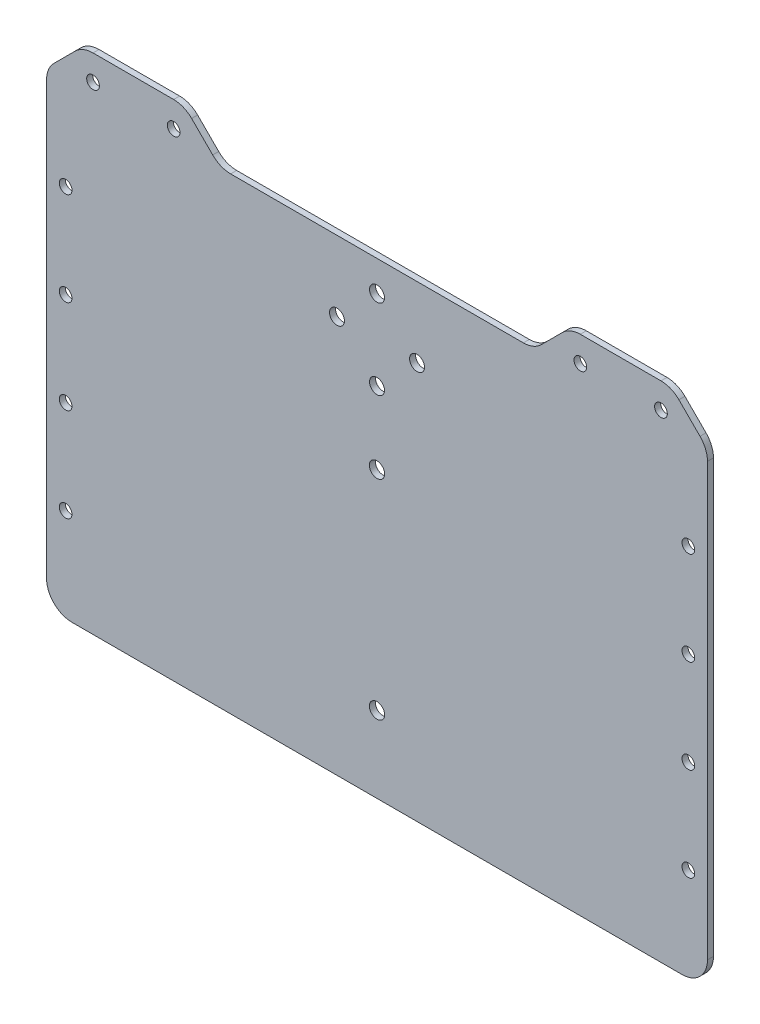
from build123d import *

# Parameters (mm, degrees)
SKETCH1_R           = 1.5875
BOSS_EXTRUDE1_DEPTH = 1.5
SKETCH2_R           = 1.906243542
CUT_EXTRUDE1_DEPTH  = 107.581175754
SKETCH3_R           = 1.8669
CUT_EXTRUDE2_DEPTH  = 107.581175754


with BuildPart() as part:
    # Sketch1 → Boss-Extrude1 (new body)
    with BuildSketch(Plane.XY):
        with BuildLine():
            Line((-82.55, 55.789743879), (-82.55, -52.07))
            ThreePointArc((-82.55, -52.07), (-80.690128061, -56.560128061), (-76.2, -58.42))
            Line((-76.2, -58.42), (76.2, -58.42))
            ThreePointArc((76.2, -58.42), (80.690128061, -56.560128061), (82.55, -52.07))
            Line((82.55, -52.07), (82.55, 55.789743879))
            ThreePointArc((82.55, 55.789743879), (82.066635031, 58.219783674), (80.690128061, 60.279871939))
            Line((80.690128061, 60.279871939), (75.429615818, 65.540384182))
            ThreePointArc((75.429615818, 65.540384182), (73.369527553, 66.916891153), (70.939487758, 67.400256121))
            Line((70.939487758, 67.400256121), (50.8, 67.400256121))
            ThreePointArc((50.8, 67.400256121), (48.369960204, 66.916891153), (46.309871939, 65.540384182))
            Line((46.309871939, 65.540384182), (41.049359697, 60.279871939))
            ThreePointArc((41.049359697, 60.279871939), (38.989271432, 58.903364969), (36.559231637, 58.42))
            Line((36.559231637, 58.42), (0, 58.42))
            Line((0, 58.42), (-36.559231637, 58.42))
            ThreePointArc((-36.559231637, 58.42), (-38.989271432, 58.903364969), (-41.049359697, 60.279871939))
            Line((-41.049359697, 60.279871939), (-46.309871939, 65.540384182))
            ThreePointArc((-46.309871939, 65.540384182), (-48.369960204, 66.916891153), (-50.8, 67.400256121))
            Line((-50.8, 67.400256121), (-70.939487758, 67.400256121))
            ThreePointArc((-70.939487758, 67.400256121), (-73.369527553, 66.916891153), (-75.429615818, 65.540384182))
            Line((-75.429615818, 65.540384182), (-80.690128061, 60.279871939))
            ThreePointArc((-80.690128061, 60.279871939), (-82.066635031, 58.219783674), (-82.55, 55.789743879))
        make_face()
        with Locations((-77.7875, -35.052)):
            Circle(SKETCH1_R, mode=Mode.SUBTRACT)
        with Locations((-77.7875, -11.684)):
            Circle(SKETCH1_R, mode=Mode.SUBTRACT)
        with Locations((-77.7875, 11.684)):
            Circle(SKETCH1_R, mode=Mode.SUBTRACT)
        with Locations((-77.7875, 35.052)):
            Circle(SKETCH1_R, mode=Mode.SUBTRACT)
        with Locations((77.7875, 35.052)):
            Circle(SKETCH1_R, mode=Mode.SUBTRACT)
        with Locations((77.7875, 11.684)):
            Circle(SKETCH1_R, mode=Mode.SUBTRACT)
        with Locations((77.7875, -11.684)):
            Circle(SKETCH1_R, mode=Mode.SUBTRACT)
        with Locations((77.7875, -35.052)):
            Circle(SKETCH1_R, mode=Mode.SUBTRACT)
        with Locations((-70.939487758, 61.050256121)):
            Circle(SKETCH1_R, mode=Mode.SUBTRACT)
        with Locations((-50.8, 61.050256121)):
            Circle(SKETCH1_R, mode=Mode.SUBTRACT)
        with Locations((50.8, 61.050256121)):
            Circle(SKETCH1_R, mode=Mode.SUBTRACT)
        with Locations((70.939487758, 61.050256121)):
            Circle(SKETCH1_R, mode=Mode.SUBTRACT)
    extrude(amount=BOSS_EXTRUDE1_DEPTH)

    # Sketch2 → Cut-Extrude1 (cut, through all)
    with BuildSketch(Plane.XY.offset(1.5)):
        with Locations((0, -39.37)):
            Circle(SKETCH2_R)
        with Locations((0, 12.713414375)):
            Circle(SKETCH2_R)
    extrude(amount=-CUT_EXTRUDE1_DEPTH, mode=Mode.SUBTRACT)

    # Sketch3 → Cut-Extrude2 (cut, through all)
    with BuildSketch(Plane.XY.offset(1.5)):
        with Locations((0, 50.8)):
            Circle(SKETCH3_R)
        with Locations((-10, 40.8)):
            Circle(SKETCH3_R)
        with Locations((0, 30.8)):
            Circle(SKETCH3_R)
        with Locations((10, 40.8)):
            Circle(SKETCH3_R)
    extrude(amount=-CUT_EXTRUDE2_DEPTH, mode=Mode.SUBTRACT)


solid = part.part
